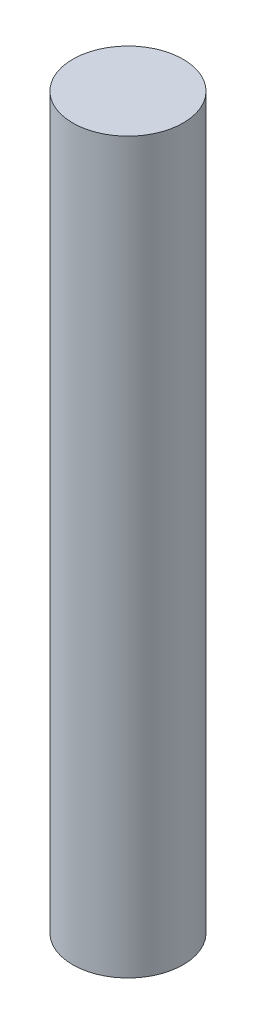
from build123d import *

# Parameters (mm, degrees)
SKETCH1_R           = 2.5
BOSS_EXTRUDE1_DEPTH = 33


with BuildPart() as part:
    # Sketch1 → Boss-Extrude1 (new body)
    with BuildSketch(Plane(origin=(0, 0, 0), x_dir=(1, 0, 0), z_dir=(0, 1, 0))):
        Circle(SKETCH1_R)
    extrude(amount=BOSS_EXTRUDE1_DEPTH)


solid = part.part
